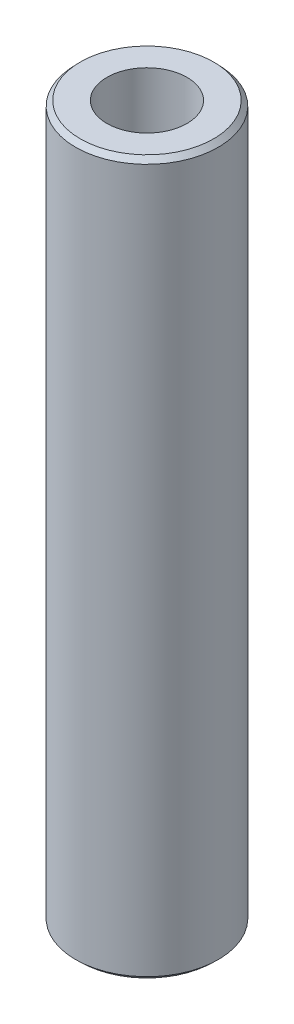
from build123d import *
from OCP.BRepFilletAPI import BRepFilletAPI_MakeChamfer

# Parameters (mm, degrees)
SKETCH1_R           = 60
BOSS_EXTRUDE1_DEPTH = 600
SKETCH2_R           = 33.696001507
CUT_EXTRUDE1_DEPTH  = 606.970296302
CHAMFER1_SIZE       = 4.169972254
CHAMFER1_SIZE2      = 3.925439209


with BuildPart() as part:
    # Sketch1 → Boss-Extrude1 (new body)
    with BuildSketch(Plane(origin=(0, 0, 0), x_dir=(1, 0, 0), z_dir=(0, 1, 0))):
        Circle(SKETCH1_R)
    extrude(amount=BOSS_EXTRUDE1_DEPTH)

    # Sketch2 → Cut-Extrude1 (cut, through all)
    with BuildSketch(Plane(origin=(0, 0, 0), x_dir=(1, 0, 0), z_dir=(0, 1, 0))):
        Circle(SKETCH2_R)
    extrude(amount=CUT_EXTRUDE1_DEPTH, mode=Mode.SUBTRACT)

    # Chamfer1: one chamfer whose edges measure the first distance from different faces: ONE call of the kernel's chamfer builder (chamfer() names one face for all edges)
    chamfer1_edges_1 = [part.edges().sort_by_distance(p)[0] for p in [
        (-60, 600, 0),
    ]]
    chamfer1_side_1 = [part.faces().sort_by_distance(p)[0] for p in [
        (-60, 300, 0),
    ]]
    chamfer1_edges_2 = [part.edges().sort_by_distance(p)[0] for p in [
        (-60, 0, 0),
    ]]
    chamfer1_side_2 = [part.faces().sort_by_distance(p)[0] for p in [
        (-58.302943725, 0, 0),
    ]]
    chamfer1 = BRepFilletAPI_MakeChamfer(part.part.solid().wrapped)
    for e in chamfer1_edges_1:
        chamfer1.Add(CHAMFER1_SIZE, CHAMFER1_SIZE2, e.wrapped, chamfer1_side_1[0].wrapped)  # the first distance lies on this face
    for e in chamfer1_edges_2:
        chamfer1.Add(CHAMFER1_SIZE, CHAMFER1_SIZE2, e.wrapped, chamfer1_side_2[0].wrapped)  # the first distance lies on this face
    add(Compound.cast(chamfer1.Shape()), mode=Mode.REPLACE)


solid = part.part
